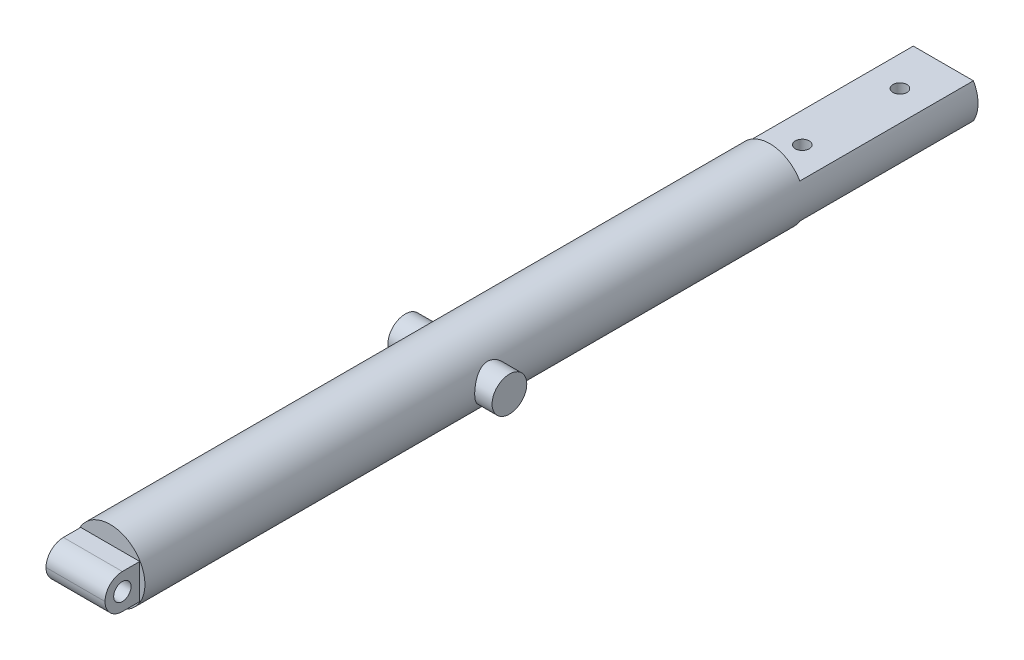
from build123d import *

# Parameters (mm, degrees)
SKETCH1_R                = 12.7
BOSS_EXTRUDE3_DEPTH      = 152.4
SKETCH9_R                = 6.35
BOSS_EXTRUDE6_DEPTH      = 19.05
SKETCH16_W               = 25.4
SKETCH16_H               = 63.5
CUT_EXTRUDE2_DEPTH       = 155.762931731
SKETCH17_W               = 25.4
SKETCH17_H               = 63.5
CUT_EXTRUDE3_DEPTH       = 155.762931731
SKETCH19_R               = 2.54
CUT_EXTRUDE5_DEPTH       = 155.762931731
SKETCH21_W               = 21.59
SKETCH21_H               = 12.7
BOSS_EXTRUDE8_DEPTH      = 12.7
BOSS_EXTRUDE9_DEPTH      = 6.35
SKETCH25_R               = 3.175
CUT_EXTRUDE7_DEPTH       = 21.59
SKETCH29_R               = 2.921
BOSS_EXTRUDE10_DEPTH     = 35.814
FILLET2_R                = 6.35
FILLET3_R                = 6.35
SKETCH31_W               = 63.5
SKETCH31_H               = 63.5
BOSS_EXTRUDE11_DEPTH     = 10.16
SKETCH32_W               = 76.52614712
SKETCH32_H               = 17.415789338
CUT_EXTRUDE8_DEPTH       = 195.047688304
SKETCH33_W               = 10.16
SKETCH33_H               = 12.7
CUT_EXTRUDE9_DEPTH       = 168.793532357
CUT_EXTRUDE11_DEPTH      = 169.255829122
CUT_EXTRUDE11_DEPTH_BACK = 169.255829122
SKETCH35_R               = 2.921


with BuildPart() as part:
    # Sketch1 → Boss-Extrude3 (new, symmetric)
    with BuildSketch(Plane.XY):
        with Locations(Location((0, 0, 0), (0, 0, 180))):
            Circle(SKETCH1_R)
    extrude(amount=BOSS_EXTRUDE3_DEPTH, both=True)

    # Sketch9 → Boss-Extrude6 (add, symmetric)
    with BuildSketch(Plane(origin=(0, 0, 0), x_dir=(0, 0, -1), z_dir=(1, 0, 0))):
        with Locations((-25.4, 0)):
            Circle(SKETCH9_R)
    extrude(amount=BOSS_EXTRUDE6_DEPTH, both=True)

    # Sketch16 → Cut-Extrude2 (cut, through all)
    with BuildSketch(Plane(origin=(0, -6.35, 0), x_dir=(1, 0, 0), z_dir=(0, 1, 0))):
        with Locations((0, 120.65)):
            Rectangle(SKETCH16_W, SKETCH16_H)
    extrude(amount=-CUT_EXTRUDE2_DEPTH, mode=Mode.SUBTRACT)

    # Sketch17 → Cut-Extrude3 (cut, through all)
    with BuildSketch(Plane(origin=(0, 6.35, 0), x_dir=(1, 0, 0), z_dir=(0, 1, 0))):
        with Locations((0, 120.65)):
            Rectangle(SKETCH17_W, SKETCH17_H)
    extrude(amount=CUT_EXTRUDE3_DEPTH, mode=Mode.SUBTRACT)

    # Sketch19 → Cut-Extrude5 (cut, through all)
    with BuildSketch(Plane(origin=(0, 6.35, 0), x_dir=(1, 0, 0), z_dir=(0, 1, 0))):
        with Locations(Location((0, 100.80625, 0), (0, 0, 270))):
            Circle(SKETCH19_R)
        with Locations(Location((0, 136.525, 0), (0, 0, 270))):
            Circle(SKETCH19_R)
    extrude(amount=-CUT_EXTRUDE5_DEPTH, mode=Mode.SUBTRACT)

    # Sketch21 → Boss-Extrude8 (add)
    with BuildSketch(Plane.XY.offset(152.4)):
        Rectangle(SKETCH21_W, SKETCH21_H)
    extrude(amount=BOSS_EXTRUDE8_DEPTH)

    # Sketch25 → Cut-Extrude7 (cut)
    with BuildSketch(Plane.ZY.offset(10.795)):
        with Locations(Location((158.75, 0, 0), (0, 0, 270))):
            Circle(SKETCH25_R)
    extrude(amount=-CUT_EXTRUDE7_DEPTH, mode=Mode.SUBTRACT)

    # Fillet3
    fillet3_edges = [part.edges().sort_by_distance(p)[0] for p in [
        (0, -6.35, 165.1),
        (0, 6.35, 165.1),
    ]]
    fillet(fillet3_edges, radius=FILLET3_R - 0.0001)  # a hair under: the kernel refuses the full size


with BuildPart() as body_2:
    # Sketch27 → Boss-Extrude9 (new, symmetric)
    with BuildSketch(Plane(origin=(0, 0, 0), x_dir=(1, 0, 0), z_dir=(0, 1, 0))):
        Polygon((0, -165.354), (11.049, -165.354), (11.049, -152.654), (21.209, -152.654), (21.209, -170.434), (-21.209, -170.434), (-21.209, -152.654), (-11.049, -152.654), (-11.049, -165.354), align=None)
    extrude(amount=BOSS_EXTRUDE9_DEPTH, both=True)

    # Sketch29 → Boss-Extrude10 (add)
    with BuildSketch(Plane.ZY.offset(21.209)):
        with Locations((158.827896988, 0)):
            Circle(SKETCH29_R)
    extrude(amount=-BOSS_EXTRUDE10_DEPTH)

    # Fillet2
    fillet2_edges = [body_2.edges().sort_by_distance(p)[0] for p in [
        (16.129, -6.35, 152.654),
        (16.129, 6.35, 152.654),
        (-16.129, -6.35, 152.654),
        (-16.129, 6.35, 152.654),
    ]]
    fillet(fillet2_edges, radius=FILLET2_R - 0.0001)  # a hair under: the kernel refuses the full size

    # Sketch31 → Boss-Extrude11 (add)
    with BuildSketch(Plane.XY.offset(170.434)):
        Rectangle(SKETCH31_W, SKETCH31_H)
    extrude(amount=BOSS_EXTRUDE11_DEPTH)

    # Sketch32 → Cut-Extrude8 (cut, through all)
    with BuildSketch(Plane(origin=(0, 31.75, 0), x_dir=(1, 0, 0), z_dir=(0, 1, 0))):
        with Locations((-0.932221908, -174.061894669)):
            Rectangle(SKETCH32_W, SKETCH32_H)
    extrude(amount=-CUT_EXTRUDE8_DEPTH, mode=Mode.SUBTRACT)

    # Sketch33 → Cut-Extrude9 (cut, through all)
    with BuildSketch(Plane(origin=(0, 6.35, 0), x_dir=(1, 0, 0), z_dir=(0, 1, 0))):
        with Locations((-16.129, -159.004)):
            Rectangle(SKETCH33_W, SKETCH33_H)
        with Locations((16.129, -159.004)):
            Rectangle(SKETCH33_W, SKETCH33_H)
    extrude(amount=-CUT_EXTRUDE9_DEPTH, mode=Mode.SUBTRACT)

    # Sketch35 → Cut-Extrude11 (cut, two sides: drawn at the far end of the back side and taken through both)
    with BuildSketch(Plane.ZY.offset(10.795).offset(-CUT_EXTRUDE11_DEPTH_BACK)):
        with Locations((158.827896988, 0)):
            Circle(SKETCH35_R)
    extrude(amount=CUT_EXTRUDE11_DEPTH + CUT_EXTRUDE11_DEPTH_BACK, mode=Mode.SUBTRACT)


solid = part.part
